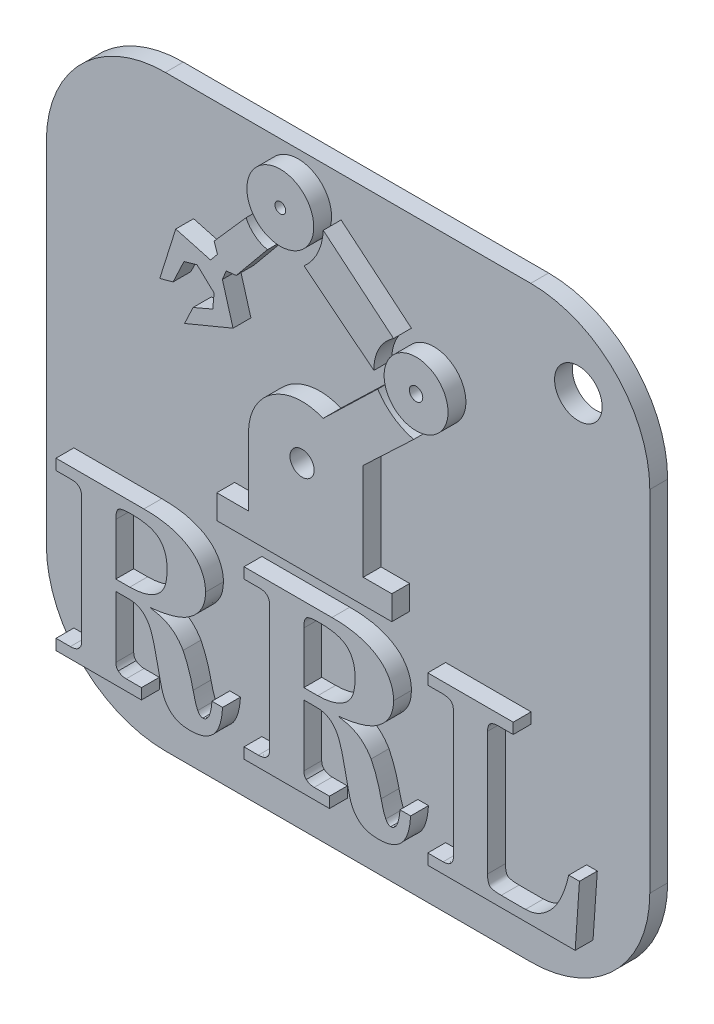
from build123d import *

# Parameters (mm, degrees)
SKETCH1_R             = 1.016959075
BOSS_EXTRUDE1_DEPTH   = 1.5
BOSS_EXTRUDE1_2_DEPTH = 1.5
BOSS_EXTRUDE1_3_DEPTH = 1.5
SKETCH1_R_2           = 2.685408693
SKETCH1_R_3           = 0.561589098
BOSS_EXTRUDE1_4_DEPTH = 1.5
SKETCH1_R_4           = 2.807006912
SKETCH1_R_5           = 0.450271141
BOSS_EXTRUDE1_5_DEPTH = 1.5
BOSS_EXTRUDE2_DEPTH   = 1.5
BOSS_EXTRUDE2_2_DEPTH = 1.5
BOSS_EXTRUDE2_3_DEPTH = 1.5
BOSS_EXTRUDE4_DEPTH   = 1.5
SKETCH5_R             = 2
CUT_EXTRUDE1_DEPTH    = 71.776797


with BuildPart() as part:
    # Sketch1 → Boss-Extrude1 (new body)
    with BuildSketch(Plane.XY):
        with BuildLine():
            Line((15.817518323, 22.448037767), (15.817518323, 20.418411873))
            Line((15.817518323, 20.418411873), (30.520730332, 20.418411873))
            Line((30.520730332, 20.418411873), (30.520730332, 22.448037767))
            Line((30.520730332, 22.448037767), (28.118803331, 22.448037767))
            Line((28.118803331, 22.448037767), (28.118803331, 30.586880413))
            Line((28.118803331, 30.586880413), (32.356715468, 34.59428744))
            ThreePointArc((32.356715468, 34.59428744), (30.63896661, 35.379763507), (29.338154461, 36.74926033))
            Line((29.338154461, 36.74926033), (24.745314888, 32.318215988))
            ThreePointArc((24.745314888, 32.318215988), (20.540196696, 31.958270733), (18.483900556, 28.272592265))
            Line((18.483900556, 28.272592265), (18.483900556, 22.448037767))
            Line((18.483900556, 22.448037767), (15.817518323, 22.448037767))
        make_face()
        with Locations((22.98159331, 28.179719688)):
            Circle(SKETCH1_R, mode=Mode.SUBTRACT)
    extrude(amount=BOSS_EXTRUDE1_DEPTH)



with BuildPart() as body_2:
    # Sketch1 → Boss-Extrude1 2 (new body)
    with BuildSketch(Plane.XY):
        with BuildLine():
            ThreePointArc((29.015655488, 37.94504893), (29.434631401, 39.731831286), (30.665977695, 41.092683339))
            Line((30.665977695, 41.092683339), (24.760616604, 46.013803391))
            ThreePointArc((24.760616604, 46.013803391), (24.30211407, 44.150054799), (23.149625269, 42.615273725))
            Line((23.149625269, 42.615273725), (29.015655488, 37.94504893))
        make_face()
    extrude(amount=BOSS_EXTRUDE1_2_DEPTH)


with BuildPart() as body_3:
    # Sketch1 → Boss-Extrude1 3 (new body)
    with BuildSketch(Plane.XY):
        with BuildLine():
            Line((17.449253701, 39.072412667), (20.074038001, 42.260506839))
            ThreePointArc((20.074038001, 42.260506839), (19.002575479, 42.756115786), (18.276240535, 43.686759495))
            Line((18.276240535, 43.686759495), (15.591529653, 40.642489121))
            Line((15.591529653, 40.642489121), (15.877221102, 39.824633398))
            Line((15.877221102, 39.824633398), (15.293805022, 39.118452198))
            Line((15.293805022, 39.118452198), (12.370296618, 39.911690131))
            Line((12.370296618, 39.911690131), (11.025557634, 35.640511645))
            Line((11.025557634, 35.640511645), (12.148988398, 35.951717417))
            Line((12.148988398, 35.951717417), (13.064422422, 37.897977453))
            Line((13.064422422, 37.897977453), (14.160422863, 38.201584647))
            Line((14.160422863, 38.201584647), (15.591529653, 36.868222472))
            Line((15.591529653, 36.868222472), (15.479169895, 35.640511645))
            Line((15.479169895, 35.640511645), (13.826060104, 34.93121306))
            Line((13.826060104, 34.93121306), (13.110313527, 33.409498853))
            Line((13.110313527, 33.409498853), (17.182830085, 35.099997561))
            Line((17.182830085, 35.099997561), (16.287520041, 38.201584647))
            Line((16.287520041, 38.201584647), (16.611482233, 38.981829317))
            Line((16.611482233, 38.981829317), (17.449253701, 39.072412667))
        make_face()
    extrude(amount=BOSS_EXTRUDE1_3_DEPTH)


with BuildPart() as body_4:
    # Sketch1 → Boss-Extrude1 4 (new body)
    with BuildSketch(Plane.XY):
        with Locations((32.558105055, 38.010940607)):
            Circle(SKETCH1_R_2)
        with Locations((32.558105055, 38.010940607)):
            Circle(SKETCH1_R_3, mode=Mode.SUBTRACT)
    extrude(amount=BOSS_EXTRUDE1_4_DEPTH)


with BuildPart() as body_5:
    # Sketch1 → Boss-Extrude1 5 (new body)
    with BuildSketch(Plane.XY):
        with Locations((21.155122038, 45.850167403)):
            Circle(SKETCH1_R_4)
        with Locations((21.155122038, 45.850167403)):
            Circle(SKETCH1_R_5, mode=Mode.SUBTRACT)
    extrude(amount=BOSS_EXTRUDE1_5_DEPTH)


with BuildPart() as body_6:
    # Sketch2 → Boss-Extrude2 (new body)
    with BuildSketch(Plane.XY):
        with BuildLine():
            Line((2.308836419, 18.20675943), (9.69585565, 18.20675943))
            add(Edge.make_bspline(
                [(9.69585565, 18.20675943), (9.842636549, 18.204682502), (10.128847257, 18.200632664), (10.548133108, 18.182533074), (10.94659102, 18.145332644), (11.324752005, 18.095786159), (11.681333758, 18.031284482), (12.017159879, 17.953977552), (12.330785454, 17.857062954), (12.626781033, 17.752121093), (12.900887854, 17.630268745), (13.158123223, 17.501487815), (13.397155113, 17.361096027), (13.618092571, 17.210007203), (13.821853124, 17.050261025), (14.00491632, 16.8777471), (14.171221258, 16.695118132), (14.366856815, 16.439663243), (14.5703299, 16.101624942), (14.747290407, 15.668881299), (14.854641212, 15.213060341), (14.866800472, 14.900839913), (14.872938983, 14.743217763)],
                knots=[0, 0, 0, 0, 1.260796864, 2.458450407, 3.603348749, 4.696868034, 5.733149247, 6.714703153, 7.654483761, 8.551049231, 9.410311666, 10.229003047, 11.020794849, 11.789116025, 12.526438116, 13.242153704, 13.946977727, 14.645554491, 16.003253973, 17.321296627, 18.647676625, 20, 20, 20, 20], degree=3))
            add(Edge.make_bspline(
                [(14.872938983, 14.743217763), (14.868551909, 14.617667346), (14.859914649, 14.370484021), (14.793718868, 14.008399689), (14.685443408, 13.66430055), (14.527595091, 13.341300966), (14.329815152, 13.035421221), (14.086436668, 12.74847169), (13.799061115, 12.480364414), (13.581926529, 12.324343985), (13.470695393, 12.244419686)],
                knots=[0, 0, 0, 0, 1.006615866, 1.981822625, 2.942272039, 3.891414032, 4.85650664, 5.856958922, 6.902188287, 8, 8, 8, 8], degree=3))
            add(Edge.make_bspline(
                [(13.470695393, 12.244419686), (13.377304484, 12.184686972), (13.182768844, 12.060262209), (12.859920038, 11.902889802), (12.500805089, 11.763303077), (12.107237722, 11.637670389), (11.678559987, 11.525905601), (11.213283148, 11.430879565), (10.71254915, 11.352629417), (10.365379081, 11.315578457), (10.186640906, 11.296503019)],
                knots=[0, 0, 0, 0, 0.770522959, 1.605018928, 2.492419048, 3.448517842, 4.476706657, 5.572020456, 6.749971061, 8, 8, 8, 8], degree=3))
            add(Edge.make_bspline(
                [(10.186640906, 11.296503019), (10.363882657, 11.264622678), (10.69965425, 11.204227693), (11.167368754, 11.077205412), (11.569913564, 10.920203556), (11.917788716, 10.735510771), (12.221078797, 10.507523862), (12.499704238, 10.239203414), (12.759553779, 9.922261839), (12.910374779, 9.685628931), (12.988323598, 9.563329943)],
                knots=[0, 0, 0, 0, 1.260855103, 2.388598191, 3.387941535, 4.281421676, 5.137767289, 6.036055688, 6.984974634, 8, 8, 8, 8], degree=3))
            add(Edge.make_bspline(
                [(12.988323598, 9.563329943), (13.073342443, 9.383138423), (13.248654333, 9.011577079), (13.465655378, 8.413397265), (13.66774967, 7.76752895), (13.774558568, 7.314903941), (13.829669752, 7.081358789)],
                knots=[0, 0, 0, 0, 0.909803941, 1.87604819, 2.904084753, 4, 4, 4, 4], degree=3))
            add(Edge.make_bspline(
                [(13.829669752, 7.081358789), (13.86238334, 6.939034232), (13.922685743, 6.676681081), (14.018288072, 6.321009191), (14.114432513, 6.037573465), (14.187589256, 5.877800027), (14.21949347, 5.808121609)],
                knots=[0, 0, 0, 0, 1.313125144, 2.420541671, 3.311186147, 4, 4, 4, 4], degree=3))
            add(Edge.make_bspline(
                [(14.21949347, 5.808121609), (14.24903681, 5.755956284), (14.303135186, 5.660433593), (14.40890838, 5.551986737), (14.519764302, 5.47725996), (14.60086211, 5.467769354), (14.640166547, 5.463169686)],
                knots=[0, 0, 0, 0, 1.257126063, 2.301990172, 3.177051494, 4, 4, 4, 4], degree=3))
            add(Edge.make_bspline(
                [(14.640166547, 5.463169686), (14.692680283, 5.467705457), (14.797086973, 5.476723381), (14.939804195, 5.562620998), (15.061329944, 5.6947992), (15.167946514, 5.875271814), (15.251378348, 6.107047611), (15.323742678, 6.385774452), (15.378622328, 6.715241488), (15.399997617, 6.952164742), (15.411400521, 7.078554302)],
                knots=[0, 0, 0, 0, 0.646043871, 1.28445065, 2.005958554, 2.858823567, 3.864198261, 5.050731084, 6.426677019, 8, 8, 8, 8], degree=3))
            Line((15.411400521, 7.078554302), (16.308836419, 7.078554302))
            add(Edge.make_bspline(
                [(16.308836419, 7.078554302), (16.299042215, 6.946603354), (16.280164582, 6.692277251), (16.229804543, 6.325916809), (16.161347484, 5.98894241), (16.069980626, 5.68117948), (15.966241219, 5.399774327), (15.838319086, 5.148893939), (15.696802528, 4.924400356), (15.531160722, 4.732401371), (15.350051893, 4.56406753), (15.148753575, 4.421823069), (14.933214703, 4.296352985), (14.696568333, 4.199322935), (14.444733887, 4.119209), (14.173369127, 4.068639384), (13.885776912, 4.032869413), (13.687697851, 4.029175012), (13.585679368, 4.02727225)],
                knots=[0, 0, 0, 0, 1.367110356, 2.635008363, 3.819206984, 4.916686227, 5.950176123, 6.913653537, 7.822085834, 8.685534134, 9.526475961, 10.371017135, 11.227791915, 12.098023441, 13.008610734, 13.954046558, 14.946253751, 16, 16, 16, 16], degree=3))
            add(Edge.make_bspline(
                [(13.585679368, 4.02727225), (13.443240381, 4.03079077), (13.172319989, 4.03748303), (12.786940326, 4.109129397), (12.444876517, 4.224400641), (12.145769225, 4.391378097), (11.886036252, 4.602452238), (11.663976017, 4.859580538), (11.469786085, 5.155907805), (11.374342431, 5.377345339), (11.325262701, 5.491214558)],
                knots=[0, 0, 0, 0, 1.180805118, 2.245903272, 3.239527271, 4.163314747, 5.073219269, 6.002236293, 6.972695423, 8, 8, 8, 8], degree=3))
            add(Edge.make_bspline(
                [(11.325262701, 5.491214558), (11.309810233, 5.531241831), (11.274969093, 5.621492516), (11.229055641, 5.777712601), (11.175283525, 5.967118458), (11.120566638, 6.192127344), (11.058339311, 6.450944065), (10.991160128, 6.744325825), (10.920873255, 7.073384506), (10.875273435, 7.304714516), (10.851304368, 7.426310712)],
                knots=[0, 0, 0, 0, 0.51621077, 1.16391579, 1.958305469, 2.886107817, 3.950407662, 5.162257264, 6.508370262, 8, 8, 8, 8], degree=3))
            add(Edge.make_bspline(
                [(10.851304368, 7.426310712), (10.822607763, 7.568462205), (10.767606122, 7.840918317), (10.68397552, 8.232041477), (10.600215458, 8.586284783), (10.518880625, 8.904184882), (10.440895395, 9.184891215), (10.36524527, 9.428999226), (10.294089063, 9.637805742), (10.198283062, 9.861556007), (10.07151947, 10.101229487), (9.902364231, 10.354243656), (9.706135871, 10.563716842), (9.490413849, 10.737178077), (9.246746645, 10.865791775), (8.980688043, 10.96433793), (8.685330252, 11.015083981), (8.480739576, 11.023117815), (8.374942188, 11.02727225)],
                knots=[0, 0, 0, 0, 1.442191922, 2.764191877, 3.977370359, 5.061944357, 6.027372746, 6.874242926, 7.603428871, 8.219893778, 9.292850582, 10.295949872, 11.236574786, 12.136774613, 13.035292675, 13.964593533, 14.947456001, 16, 16, 16, 16], degree=3))
            Line((8.374942188, 11.02727225), (7.334477444, 11.02727225))
            Line((7.334477444, 11.02727225), (7.334477444, 5.861406866))
            add(Edge.make_bspline(
                [(7.334477444, 5.861406866), (7.33740025, 5.807920473), (7.342962029, 5.70614174), (7.378560153, 5.561942779), (7.443937345, 5.437950826), (7.505848883, 5.372212368), (7.536400521, 5.33977225)],
                knots=[0, 0, 0, 0, 1.11562849, 2.122918543, 3.073711999, 4, 4, 4, 4], degree=3))
            add(Edge.make_bspline(
                [(7.536400521, 5.33977225), (7.584647984, 5.303023158), (7.680339408, 5.230136984), (7.846802651, 5.159075433), (8.022585005, 5.110943029), (8.144636137, 5.106469273), (8.206672957, 5.104195327)],
                knots=[0, 0, 0, 0, 1.000506897, 1.984351599, 2.975475153, 4, 4, 4, 4], degree=3))
            Line((8.206672957, 5.104195327), (9.488323598, 5.104195327))
            Line((9.488323598, 5.104195327), (9.488323598, 4.20675943))
            Line((9.488323598, 4.20675943), (2.308836419, 4.20675943))
            Line((2.308836419, 4.20675943), (2.308836419, 5.104195327))
            Line((2.308836419, 5.104195327), (3.514765906, 5.104195327))
            add(Edge.make_bspline(
                [(3.514765906, 5.104195327), (3.587921751, 5.106576709), (3.72716826, 5.111109487), (3.92062123, 5.152806456), (4.088456257, 5.220064718), (4.223709566, 5.320469724), (4.334774396, 5.443099605), (4.409863688, 5.592430313), (4.456525097, 5.762323763), (4.460566509, 5.882577318), (4.462682573, 5.945541481)],
                knots=[0, 0, 0, 0, 1.215748592, 2.314083659, 3.276082243, 4.200108988, 5.092704252, 6.004076111, 6.954944175, 8, 8, 8, 8], degree=3))
            Line((4.462682573, 5.945541481), (4.462682573, 16.467977378))
            add(Edge.make_bspline(
                [(4.462682573, 16.467977378), (4.460010941, 16.535454307), (4.454986482, 16.662356184), (4.417545931, 16.840642003), (4.347026623, 16.989619822), (4.247896672, 17.109290868), (4.123572966, 17.200909337), (3.975183188, 17.265718311), (3.8033535, 17.300798085), (3.682254817, 17.306384124), (3.618531932, 17.309323532)],
                knots=[0, 0, 0, 0, 1.186255313, 2.230955505, 3.179282011, 4.054730626, 4.935716216, 5.870269018, 6.87932221, 8, 8, 8, 8], degree=3))
            Line((3.618531932, 17.309323532), (2.308836419, 17.309323532))
            Line((2.308836419, 17.309323532), (2.308836419, 18.20675943))
        make_face()
        with BuildLine():
            Line((7.334477444, 11.924708148), (8.506753085, 11.924708148))
            add(Edge.make_bspline(
                [(8.506753085, 11.924708148), (8.633083368, 11.926201443), (8.879854944, 11.929118423), (9.239507441, 11.971090897), (9.579460942, 12.030565312), (9.898778737, 12.117773265), (10.196671539, 12.230911916), (10.476799127, 12.364061768), (10.733440661, 12.528004954), (10.888934342, 12.655134452), (10.966288342, 12.718378019)],
                knots=[0, 0, 0, 0, 1.146952266, 2.240438413, 3.284842864, 4.279918954, 5.24205365, 6.176390374, 7.092802377, 8, 8, 8, 8], degree=3))
            add(Edge.make_bspline(
                [(10.966288342, 12.718378019), (11.020286355, 12.772097204), (11.129922222, 12.881166947), (11.266584303, 13.075344503), (11.385283242, 13.292212376), (11.480939432, 13.536321837), (11.551921286, 13.806743606), (11.605542395, 14.10200237), (11.635556856, 14.423824263), (11.639907498, 14.646869652), (11.642169752, 14.762849173)],
                knots=[0, 0, 0, 0, 0.823637118, 1.672286907, 2.560369197, 3.496721298, 4.503762865, 5.584178681, 6.743817119, 8, 8, 8, 8], degree=3))
            add(Edge.make_bspline(
                [(11.642169752, 14.762849173), (11.639968703, 14.869500892), (11.63571134, 15.075791216), (11.604469124, 15.373917905), (11.554961643, 15.651052911), (11.483360756, 15.906358694), (11.387189736, 16.138380548), (11.270975727, 16.347787132), (11.137559805, 16.537885863), (10.976680989, 16.702996244), (10.792178939, 16.847850651), (10.577637209, 16.972296577), (10.333598741, 17.077325316), (10.058796307, 17.165633613), (9.752686443, 17.22682683), (9.41749733, 17.274178388), (9.052380659, 17.30653947), (8.798493442, 17.308371739), (8.666608855, 17.309323532)],
                knots=[0, 0, 0, 0, 1.12607714, 2.178106663, 3.161725867, 4.096006619, 4.972319557, 5.807464053, 6.621093994, 7.416983527, 8.232587358, 9.090979501, 10.028176308, 11.033452721, 12.133172423, 13.319842628, 14.607761926, 16, 16, 16, 16], degree=3))
            add(Edge.make_bspline(
                [(8.666608855, 17.309323532), (8.596500242, 17.308731814), (8.463704089, 17.307611011), (8.273561225, 17.300720356), (8.104641782, 17.282007297), (7.954881244, 17.265833898), (7.827553492, 17.234932138), (7.717769508, 17.207830047), (7.62948437, 17.167638825), (7.534120744, 17.107110746), (7.447459827, 16.985043364), (7.379424873, 16.795004687), (7.340618887, 16.547977292), (7.336657916, 16.36434009), (7.334477444, 16.263249814)],
                knots=[0, 0, 0, 0, 1.234073475, 2.337518953, 3.345986092, 4.225559855, 4.983998792, 5.650694609, 6.210333431, 6.684906202, 7.622862998, 8.768671454, 10.221188891, 12, 12, 12, 12], degree=3))
            Line((7.334477444, 16.263249814), (7.334477444, 11.924708148))
        make_face(mode=Mode.SUBTRACT)
    extrude(amount=BOSS_EXTRUDE2_DEPTH)


with BuildPart() as body_7:
    # Sketch2 → Boss-Extrude2 2 (new body)
    with BuildSketch(Plane.XY):
        with BuildLine():
            Line((18.103708214, 18.20675943), (25.490727444, 18.20675943))
            add(Edge.make_bspline(
                [(25.490727444, 18.20675943), (25.637508344, 18.204682502), (25.923719051, 18.200632664), (26.343004903, 18.182533074), (26.741462815, 18.145332644), (27.1196238, 18.095786159), (27.476205553, 18.031284482), (27.812031674, 17.953977552), (28.125657249, 17.857062954), (28.421652828, 17.752121093), (28.695759649, 17.630268745), (28.952995018, 17.501487815), (29.192026908, 17.361096027), (29.412964365, 17.210007203), (29.616724919, 17.050261025), (29.799788115, 16.8777471), (29.966093052, 16.695118132), (30.161728609, 16.439663243), (30.365201695, 16.101624942), (30.542162202, 15.668881299), (30.649513007, 15.213060341), (30.661672266, 14.900839913), (30.667810778, 14.743217763)],
                knots=[0, 0, 0, 0, 1.260796864, 2.458450407, 3.603348749, 4.696868034, 5.733149247, 6.714703153, 7.654483761, 8.551049231, 9.410311666, 10.229003047, 11.020794849, 11.789116025, 12.526438116, 13.242153704, 13.946977727, 14.645554491, 16.003253973, 17.321296627, 18.647676625, 20, 20, 20, 20], degree=3))
            add(Edge.make_bspline(
                [(30.667810778, 14.743217763), (30.663423704, 14.617667346), (30.654786444, 14.370484021), (30.588590663, 14.008399689), (30.480315203, 13.66430055), (30.322466885, 13.341300966), (30.124686946, 13.035421221), (29.881308463, 12.74847169), (29.59393291, 12.480364414), (29.376798323, 12.324343985), (29.265567188, 12.244419686)],
                knots=[0, 0, 0, 0, 1.006615866, 1.981822625, 2.942272039, 3.891414032, 4.85650664, 5.856958922, 6.902188287, 8, 8, 8, 8], degree=3))
            add(Edge.make_bspline(
                [(29.265567188, 12.244419686), (29.172176279, 12.184686972), (28.977640639, 12.060262209), (28.654791833, 11.902889802), (28.295676884, 11.763303077), (27.902109517, 11.637670389), (27.473431782, 11.525905601), (27.008154943, 11.430879565), (26.507420945, 11.352629417), (26.160250876, 11.315578457), (25.981512701, 11.296503019)],
                knots=[0, 0, 0, 0, 0.770522959, 1.605018928, 2.492419048, 3.448517842, 4.476706657, 5.572020456, 6.749971061, 8, 8, 8, 8], degree=3))
            add(Edge.make_bspline(
                [(25.981512701, 11.296503019), (26.158754452, 11.264622678), (26.494526045, 11.204227693), (26.962240549, 11.077205412), (27.364785359, 10.920203556), (27.712660511, 10.735510771), (28.015950591, 10.507523862), (28.294576033, 10.239203414), (28.554425574, 9.922261839), (28.705246574, 9.685628931), (28.783195393, 9.563329943)],
                knots=[0, 0, 0, 0, 1.260855103, 2.388598191, 3.387941535, 4.281421676, 5.137767289, 6.036055688, 6.984974634, 8, 8, 8, 8], degree=3))
            add(Edge.make_bspline(
                [(28.783195393, 9.563329943), (28.868214238, 9.383138423), (29.043526128, 9.011577079), (29.260527173, 8.413397265), (29.462621465, 7.76752895), (29.569430363, 7.314903941), (29.624541547, 7.081358789)],
                knots=[0, 0, 0, 0, 0.909803941, 1.87604819, 2.904084753, 4, 4, 4, 4], degree=3))
            add(Edge.make_bspline(
                [(29.624541547, 7.081358789), (29.657255135, 6.939034232), (29.717557538, 6.676681081), (29.813159867, 6.321009191), (29.909304308, 6.037573465), (29.98246105, 5.877800027), (30.014365265, 5.808121609)],
                knots=[0, 0, 0, 0, 1.313125144, 2.420541671, 3.311186147, 4, 4, 4, 4], degree=3))
            add(Edge.make_bspline(
                [(30.014365265, 5.808121609), (30.043908605, 5.755956284), (30.098006981, 5.660433593), (30.203780175, 5.551986737), (30.314636097, 5.47725996), (30.395733905, 5.467769354), (30.435038342, 5.463169686)],
                knots=[0, 0, 0, 0, 1.257126063, 2.301990172, 3.177051494, 4, 4, 4, 4], degree=3))
            add(Edge.make_bspline(
                [(30.435038342, 5.463169686), (30.487552078, 5.467705457), (30.591958768, 5.476723381), (30.73467599, 5.562620998), (30.856201739, 5.6947992), (30.962818309, 5.875271814), (31.046250143, 6.107047611), (31.118614473, 6.385774452), (31.173494123, 6.715241488), (31.194869412, 6.952164742), (31.206272316, 7.078554302)],
                knots=[0, 0, 0, 0, 0.646043871, 1.28445065, 2.005958554, 2.858823567, 3.864198261, 5.050731084, 6.426677019, 8, 8, 8, 8], degree=3))
            Line((31.206272316, 7.078554302), (32.103708214, 7.078554302))
            add(Edge.make_bspline(
                [(32.103708214, 7.078554302), (32.09391401, 6.946603354), (32.075036377, 6.692277251), (32.024676338, 6.325916809), (31.956219279, 5.98894241), (31.864852421, 5.68117948), (31.761113014, 5.399774327), (31.633190881, 5.148893939), (31.491674323, 4.924400356), (31.326032517, 4.732401371), (31.144923688, 4.56406753), (30.94362537, 4.421823069), (30.728086498, 4.296352985), (30.491440128, 4.199322935), (30.239605682, 4.119209), (29.968240922, 4.068639384), (29.680648707, 4.032869413), (29.482569646, 4.029175012), (29.380551162, 4.02727225)],
                knots=[0, 0, 0, 0, 1.367110356, 2.635008363, 3.819206984, 4.916686227, 5.950176123, 6.913653537, 7.822085834, 8.685534134, 9.526475961, 10.371017135, 11.227791915, 12.098023441, 13.008610734, 13.954046558, 14.946253751, 16, 16, 16, 16], degree=3))
            add(Edge.make_bspline(
                [(29.380551162, 4.02727225), (29.238112176, 4.03079077), (28.967191784, 4.03748303), (28.58181212, 4.109129397), (28.239748312, 4.224400641), (27.94064102, 4.391378097), (27.680908047, 4.602452238), (27.458847812, 4.859580538), (27.26465788, 5.155907805), (27.169214225, 5.377345339), (27.120134496, 5.491214558)],
                knots=[0, 0, 0, 0, 1.180805118, 2.245903272, 3.239527271, 4.163314747, 5.073219269, 6.002236293, 6.972695423, 8, 8, 8, 8], degree=3))
            add(Edge.make_bspline(
                [(27.120134496, 5.491214558), (27.104682028, 5.531241831), (27.069840888, 5.621492516), (27.023927436, 5.777712601), (26.97015532, 5.967118458), (26.915438433, 6.192127344), (26.853211106, 6.450944065), (26.786031923, 6.744325825), (26.71574505, 7.073384506), (26.67014523, 7.304714516), (26.646176162, 7.426310712)],
                knots=[0, 0, 0, 0, 0.51621077, 1.16391579, 1.958305469, 2.886107817, 3.950407662, 5.162257264, 6.508370262, 8, 8, 8, 8], degree=3))
            add(Edge.make_bspline(
                [(26.646176162, 7.426310712), (26.617479558, 7.568462205), (26.562477917, 7.840918317), (26.478847315, 8.232041477), (26.395087253, 8.586284783), (26.31375242, 8.904184882), (26.23576719, 9.184891215), (26.160117065, 9.428999226), (26.088960858, 9.637805742), (25.993154857, 9.861556007), (25.866391265, 10.101229487), (25.697236026, 10.354243656), (25.501007665, 10.563716842), (25.285285644, 10.737178077), (25.04161844, 10.865791775), (24.775559838, 10.96433793), (24.480202047, 11.015083981), (24.275611371, 11.023117815), (24.169813983, 11.02727225)],
                knots=[0, 0, 0, 0, 1.442191922, 2.764191877, 3.977370359, 5.061944357, 6.027372746, 6.874242926, 7.603428871, 8.219893778, 9.292850582, 10.295949872, 11.236574786, 12.136774613, 13.035292675, 13.964593533, 14.947456001, 16, 16, 16, 16], degree=3))
            Line((24.169813983, 11.02727225), (23.129349239, 11.02727225))
            Line((23.129349239, 11.02727225), (23.129349239, 5.861406866))
            add(Edge.make_bspline(
                [(23.129349239, 5.861406866), (23.132272045, 5.807920473), (23.137833824, 5.70614174), (23.173431948, 5.561942779), (23.23880914, 5.437950826), (23.300720678, 5.372212368), (23.331272316, 5.33977225)],
                knots=[0, 0, 0, 0, 1.11562849, 2.122918543, 3.073711999, 4, 4, 4, 4], degree=3))
            add(Edge.make_bspline(
                [(23.331272316, 5.33977225), (23.379519779, 5.303023158), (23.475211203, 5.230136984), (23.641674446, 5.159075433), (23.8174568, 5.110943029), (23.939507932, 5.106469273), (24.001544752, 5.104195327)],
                knots=[0, 0, 0, 0, 1.000506897, 1.984351599, 2.975475153, 4, 4, 4, 4], degree=3))
            Line((24.001544752, 5.104195327), (25.283195393, 5.104195327))
            Line((25.283195393, 5.104195327), (25.283195393, 4.20675943))
            Line((25.283195393, 4.20675943), (18.103708214, 4.20675943))
            Line((18.103708214, 4.20675943), (18.103708214, 5.104195327))
            Line((18.103708214, 5.104195327), (19.309637701, 5.104195327))
            add(Edge.make_bspline(
                [(19.309637701, 5.104195327), (19.382793546, 5.106576709), (19.522040054, 5.111109487), (19.715493024, 5.152806456), (19.883328052, 5.220064718), (20.018581361, 5.320469724), (20.129646191, 5.443099605), (20.204735483, 5.592430313), (20.251396892, 5.762323763), (20.255438304, 5.882577318), (20.257554368, 5.945541481)],
                knots=[0, 0, 0, 0, 1.215748592, 2.314083659, 3.276082243, 4.200108988, 5.092704252, 6.004076111, 6.954944175, 8, 8, 8, 8], degree=3))
            Line((20.257554368, 5.945541481), (20.257554368, 16.467977378))
            add(Edge.make_bspline(
                [(20.257554368, 16.467977378), (20.254882736, 16.535454307), (20.249858277, 16.662356184), (20.212417725, 16.840642003), (20.141898418, 16.989619822), (20.042768467, 17.109290868), (19.918444761, 17.200909337), (19.770054983, 17.265718311), (19.598225294, 17.300798085), (19.477126612, 17.306384124), (19.413403726, 17.309323532)],
                knots=[0, 0, 0, 0, 1.186255313, 2.230955505, 3.179282011, 4.054730626, 4.935716216, 5.870269018, 6.87932221, 8, 8, 8, 8], degree=3))
            Line((19.413403726, 17.309323532), (18.103708214, 17.309323532))
            Line((18.103708214, 17.309323532), (18.103708214, 18.20675943))
        make_face()
        with BuildLine():
            Line((23.129349239, 11.924708148), (24.30162488, 11.924708148))
            add(Edge.make_bspline(
                [(24.30162488, 11.924708148), (24.427955163, 11.926201443), (24.674726739, 11.929118423), (25.034379236, 11.971090897), (25.374332736, 12.030565312), (25.693650532, 12.117773265), (25.991543334, 12.230911916), (26.271670922, 12.364061768), (26.528312456, 12.528004954), (26.683806137, 12.655134452), (26.761160137, 12.718378019)],
                knots=[0, 0, 0, 0, 1.146952266, 2.240438413, 3.284842864, 4.279918954, 5.24205365, 6.176390374, 7.092802377, 8, 8, 8, 8], degree=3))
            add(Edge.make_bspline(
                [(26.761160137, 12.718378019), (26.81515815, 12.772097204), (26.924794017, 12.881166947), (27.061456097, 13.075344503), (27.180155036, 13.292212376), (27.275811227, 13.536321837), (27.346793081, 13.806743606), (27.40041419, 14.10200237), (27.430428651, 14.423824263), (27.434779293, 14.646869652), (27.437041547, 14.762849173)],
                knots=[0, 0, 0, 0, 0.823637118, 1.672286907, 2.560369197, 3.496721298, 4.503762865, 5.584178681, 6.743817119, 8, 8, 8, 8], degree=3))
            add(Edge.make_bspline(
                [(27.437041547, 14.762849173), (27.434840498, 14.869500892), (27.430583135, 15.075791216), (27.399340919, 15.373917905), (27.349833438, 15.651052911), (27.278232551, 15.906358694), (27.18206153, 16.138380548), (27.065847522, 16.347787132), (26.9324316, 16.537885863), (26.771552784, 16.702996244), (26.587050734, 16.847850651), (26.372509004, 16.972296577), (26.128470536, 17.077325316), (25.853668102, 17.165633613), (25.547558237, 17.22682683), (25.212369125, 17.274178388), (24.847252454, 17.30653947), (24.593365237, 17.308371739), (24.46148065, 17.309323532)],
                knots=[0, 0, 0, 0, 1.12607714, 2.178106663, 3.161725867, 4.096006619, 4.972319557, 5.807464053, 6.621093994, 7.416983527, 8.232587358, 9.090979501, 10.028176308, 11.033452721, 12.133172423, 13.319842628, 14.607761926, 16, 16, 16, 16], degree=3))
            add(Edge.make_bspline(
                [(24.46148065, 17.309323532), (24.391372037, 17.308731814), (24.258575884, 17.307611011), (24.06843302, 17.300720356), (23.899513577, 17.282007297), (23.749753039, 17.265833898), (23.622425286, 17.234932138), (23.512641303, 17.207830047), (23.424356165, 17.167638825), (23.328992539, 17.107110746), (23.242331622, 16.985043364), (23.174296668, 16.795004687), (23.135490682, 16.547977292), (23.131529711, 16.36434009), (23.129349239, 16.263249814)],
                knots=[0, 0, 0, 0, 1.234073475, 2.337518953, 3.345986092, 4.225559855, 4.983998792, 5.650694609, 6.210333431, 6.684906202, 7.622862998, 8.768671454, 10.221188891, 12, 12, 12, 12], degree=3))
            Line((23.129349239, 16.263249814), (23.129349239, 11.924708148))
        make_face(mode=Mode.SUBTRACT)
    extrude(amount=BOSS_EXTRUDE2_2_DEPTH)


with BuildPart() as body_8:
    # Sketch2 → Boss-Extrude2 3 (new body)
    with BuildSketch(Plane.XY):
        with BuildLine():
            Line((33.53960565, 17.309323532), (33.53960565, 18.20675943))
            Line((33.53960565, 18.20675943), (40.719092829, 18.20675943))
            Line((40.719092829, 18.20675943), (40.719092829, 17.309323532))
            Line((40.719092829, 17.309323532), (39.50474988, 17.309323532))
            add(Edge.make_bspline(
                [(39.50474988, 17.309323532), (39.424104429, 17.308222154), (39.27475161, 17.306182436), (39.070005273, 17.265475012), (38.900705635, 17.207874577), (38.768368864, 17.117158201), (38.67600585, 16.994882824), (38.610444561, 16.846354582), (38.572593405, 16.667061667), (38.567806391, 16.537341461), (38.565246675, 16.467977378)],
                knots=[0, 0, 0, 0, 1.317174052, 2.439364582, 3.40274332, 4.226216974, 5.021934816, 5.877883306, 6.86526021, 8, 8, 8, 8], degree=3))
            Line((38.565246675, 16.467977378), (38.565246675, 6.08576584))
            add(Edge.make_bspline(
                [(38.565246675, 6.08576584), (38.566265613, 5.990225478), (38.568114911, 5.816826611), (38.607049339, 5.58436863), (38.664146576, 5.404511283), (38.757725071, 5.266287503), (38.915444852, 5.188638406), (39.122480882, 5.14154883), (39.395373811, 5.108306373), (39.599065129, 5.105664016), (39.712281932, 5.104195327)],
                knots=[0, 0, 0, 0, 1.253318516, 2.274682744, 3.08242206, 3.723352428, 4.399534733, 5.325689848, 6.513550565, 8, 8, 8, 8], degree=3))
            Line((39.712281932, 5.104195327), (41.751144111, 5.104195327))
            add(Edge.make_bspline(
                [(41.751144111, 5.104195327), (41.845778793, 5.107558783), (42.034366239, 5.114261457), (42.313505928, 5.164468449), (42.588718942, 5.241315459), (42.854951373, 5.36064889), (43.12084816, 5.502312068), (43.37860086, 5.681266371), (43.632482705, 5.890698393), (43.881757458, 6.131064811), (44.121971761, 6.407469014), (44.346035726, 6.723704606), (44.556252913, 7.078575281), (44.75153563, 7.47191783), (44.933176262, 7.902088084), (45.102758185, 8.369539025), (45.251912026, 8.877229971), (45.340276716, 9.23020533), (45.385759496, 9.411887635)],
                knots=[0, 0, 0, 0, 0.746952398, 1.488522408, 2.233867827, 2.997739128, 3.787258218, 4.610437708, 5.470623944, 6.384302497, 7.342016262, 8.35813022, 9.440650158, 10.596202486, 11.823439516, 13.126538548, 14.520981459, 16, 16, 16, 16], degree=3))
            Line((45.385759496, 9.411887635), (46.283195393, 9.411887635))
            Line((46.283195393, 9.411887635), (45.924221034, 4.20675943))
            Line((45.924221034, 4.20675943), (33.53960565, 4.20675943))
            Line((33.53960565, 4.20675943), (33.53960565, 5.104195327))
            Line((33.53960565, 5.104195327), (34.829669752, 5.104195327))
            add(Edge.make_bspline(
                [(34.829669752, 5.104195327), (34.896214719, 5.106915832), (35.023097576, 5.112103084), (35.200476953, 5.149698943), (35.351763866, 5.21621425), (35.478791934, 5.305876887), (35.574443789, 5.424813429), (35.647790826, 5.561985948), (35.685503394, 5.723932342), (35.690710206, 5.837871583), (35.693451803, 5.897865199)],
                knots=[0, 0, 0, 0, 1.195528741, 2.279542841, 3.234602015, 4.14844858, 5.043106676, 5.952155301, 6.921726988, 8, 8, 8, 8], degree=3))
            Line((35.693451803, 5.897865199), (35.693451803, 16.571743404))
            add(Edge.make_bspline(
                [(35.693451803, 16.571743404), (35.691093083, 16.631837811), (35.686639687, 16.745299418), (35.645016135, 16.902907964), (35.573279091, 17.034622607), (35.469840075, 17.14044532), (35.33203828, 17.22122246), (35.154965454, 17.270918689), (34.941267316, 17.304510436), (34.784965611, 17.307637131), (34.700663342, 17.309323532)],
                knots=[0, 0, 0, 0, 1.00990991, 1.906766507, 2.716615905, 3.506507968, 4.367174043, 5.37229384, 6.582730811, 8, 8, 8, 8], degree=3))
            Line((34.700663342, 17.309323532), (33.53960565, 17.309323532))
        make_face()
    extrude(amount=BOSS_EXTRUDE2_3_DEPTH)


with BuildPart() as part_1:
    add(part.part)

    add(body_2.part)  # Boss-Extrude4 merges body 2

    add(body_3.part)  # Boss-Extrude4 merges body 3

    add(body_4.part)  # Boss-Extrude4 merges body 4

    add(body_5.part)  # Boss-Extrude4 merges body 5

    add(body_6.part)  # Boss-Extrude4 merges body 6

    add(body_7.part)  # Boss-Extrude4 merges body 7

    add(body_8.part)  # Boss-Extrude4 merges body 8
    # Sketch4 → Boss-Extrude4 (add)
    with BuildSketch(Plane.XY):
        with BuildLine():
            Line((10, 0), (40.691596326, 0))
            ThreePointArc((40.691596326, 0), (47.762664137, 2.928932188), (50.691596326, 10))
            Line((50.691596326, 10), (50.691596326, 39.370710297))
            ThreePointArc((50.691596326, 39.370710297), (47.762664137, 46.441778109), (40.691596326, 49.370710297))
            Line((40.691596326, 49.370710297), (10, 49.370710297))
            ThreePointArc((10, 49.370710297), (2.928932188, 46.441778109), (0, 39.370710297))
            Line((0, 39.370710297), (0, 10))
            ThreePointArc((0, 10), (2.928932188, 2.928932188), (10, 0))
        make_face()
    extrude(amount=-BOSS_EXTRUDE4_DEPTH)

    # Sketch5 → Cut-Extrude1 (cut, through all)
    with BuildSketch(Plane.XY):
        with Locations((44.691596326, 43.370710297)):
            Circle(SKETCH5_R)
    extrude(amount=-CUT_EXTRUDE1_DEPTH, mode=Mode.SUBTRACT)


solid = part_1.part
